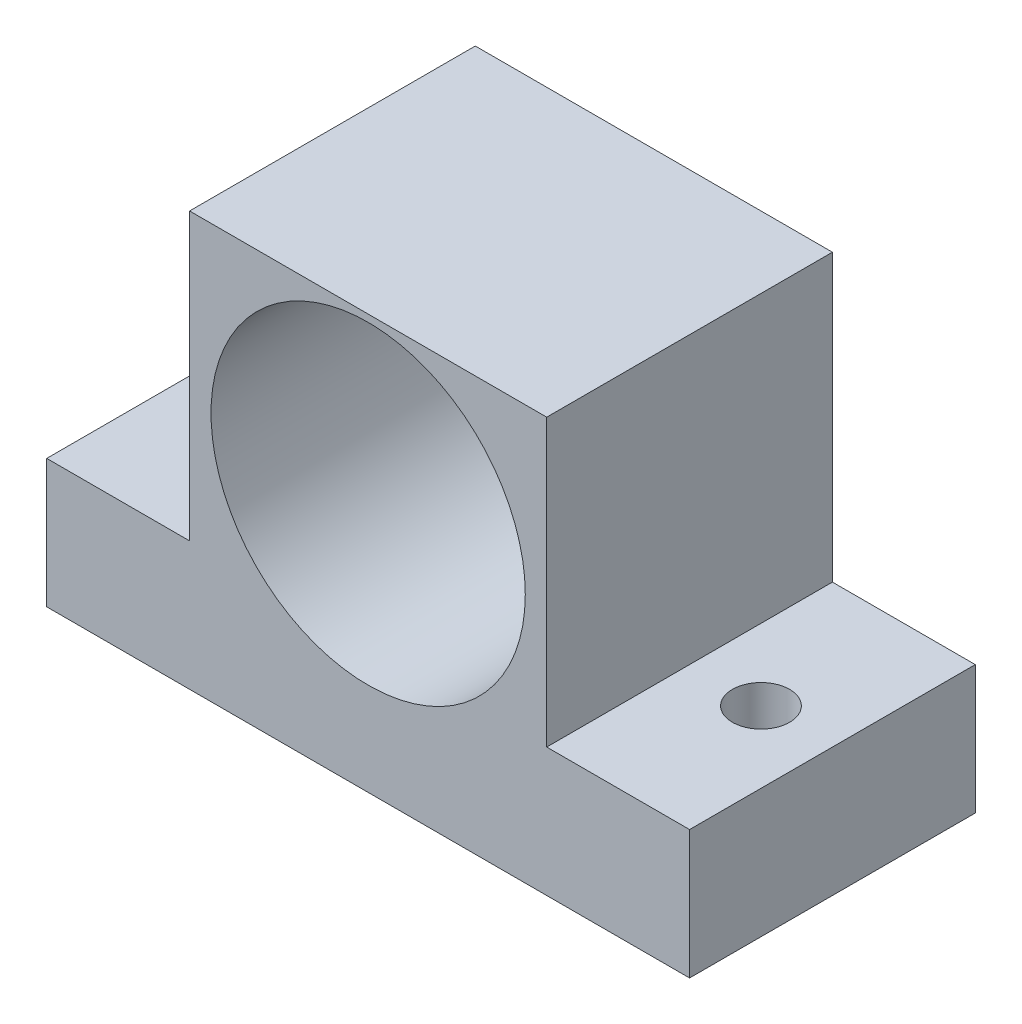
from build123d import *

# Parameters (mm, degrees)
SKETCH1_R           = 11
BOSS_EXTRUDE1_DEPTH = 20
SKETCH2_R           = 2
CUT_EXTRUDE1_DEPTH  = 9


with BuildPart() as part:
    # Sketch1 → Boss-Extrude1 (new body)
    with BuildSketch(Plane.XY):
        Polygon((12.5, 11.5), (-12.5, 11.5), (-12.5, -8.5), (-22.5, -8.5), (-22.5, -17.5), (22.5, -17.5), (22.5, -8.5), (12.5, -8.5), align=None)
        Circle(SKETCH1_R, mode=Mode.SUBTRACT)
    extrude(amount=BOSS_EXTRUDE1_DEPTH)

    # Sketch2 → Cut-Extrude1 (cut)
    with BuildSketch(Plane(origin=(0, -8.5, 0), x_dir=(1, 0, 0), z_dir=(0, 1, 0))):
        with Locations((-17.5, -10)):
            Circle(SKETCH2_R)
        with Locations((17.5, -10)):
            Circle(SKETCH2_R)
    extrude(amount=-CUT_EXTRUDE1_DEPTH, mode=Mode.SUBTRACT)


solid = part.part
